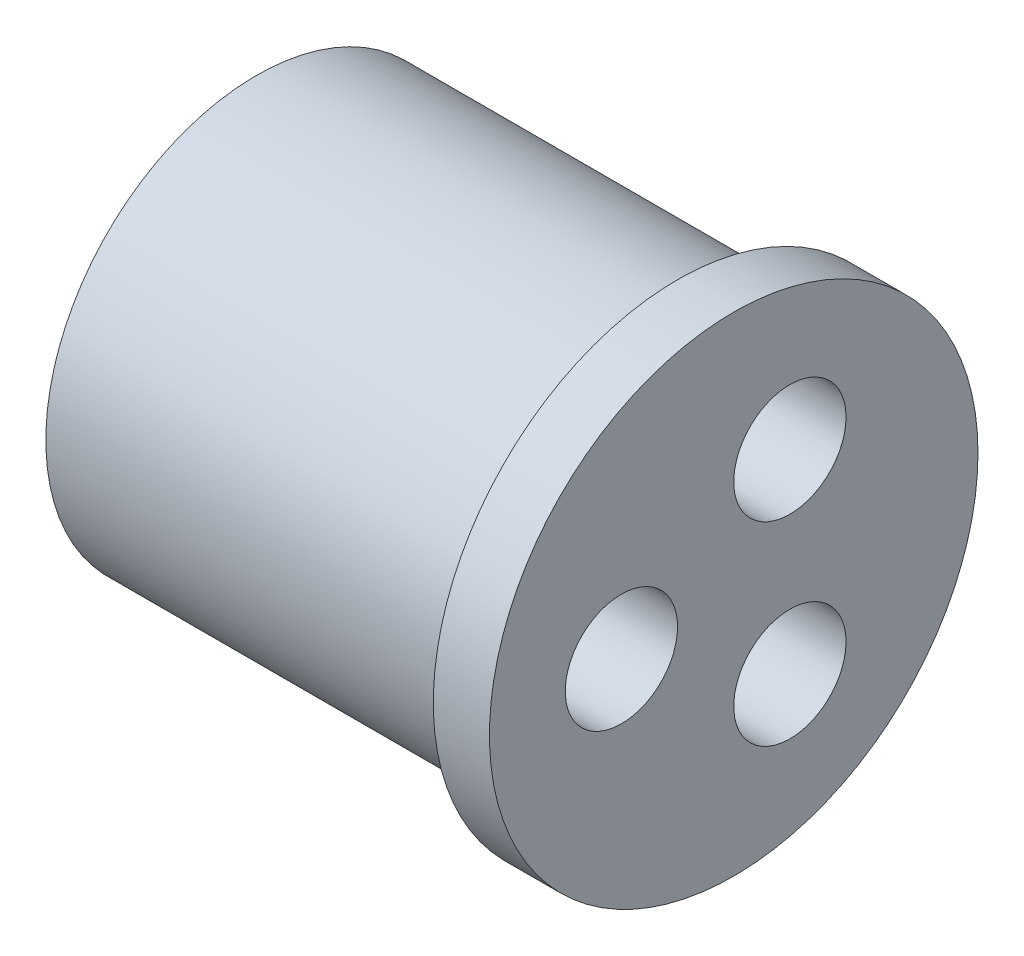
from build123d import *

# Parameters (mm, degrees)
BOSS_EXTRUDE1_OUTLINE_R   = 37.5
BOSS_EXTRUDE1_OUTLINE_R_2 = 10
BOSS_EXTRUDE1_DEPTH       = 75
SKETCH3_R                 = 43.5
SKETCH3_R_2               = 10
BOSS_EXTRUDE2_DEPTH       = 10


# Read off the part's stored shape, not the designer's step: Boss-Extrude1
with BuildPart() as part:
    # Boss-Extrude1 outline → Boss-Extrude1 (new body)
    with BuildSketch(Plane(origin=(0, 0, 0), x_dir=(0, 0, -1), z_dir=(1, 0, 0))):
        Circle(BOSS_EXTRUDE1_OUTLINE_R)
        with Locations((10, -17.320508076)):
            Circle(BOSS_EXTRUDE1_OUTLINE_R_2, mode=Mode.SUBTRACT)
        with Locations((-20, 0)):
            Circle(BOSS_EXTRUDE1_OUTLINE_R_2, mode=Mode.SUBTRACT)
        with Locations((10, 17.320508076)):
            Circle(BOSS_EXTRUDE1_OUTLINE_R_2, mode=Mode.SUBTRACT)
    extrude(amount=BOSS_EXTRUDE1_DEPTH)

    # Sketch3 → Boss-Extrude2 (add)
    with BuildSketch(Plane(origin=(75, 0, 0), x_dir=(0, 0, -1), z_dir=(1, 0, 0))):
        Circle(SKETCH3_R)
        with Locations((-20, 0)):
            Circle(SKETCH3_R_2, mode=Mode.SUBTRACT)
        with Locations((10, 17.320508076)):
            Circle(SKETCH3_R_2, mode=Mode.SUBTRACT)
        with Locations((10, -17.320508076)):
            Circle(SKETCH3_R_2, mode=Mode.SUBTRACT)
    extrude(amount=BOSS_EXTRUDE2_DEPTH)


solid = part.part
